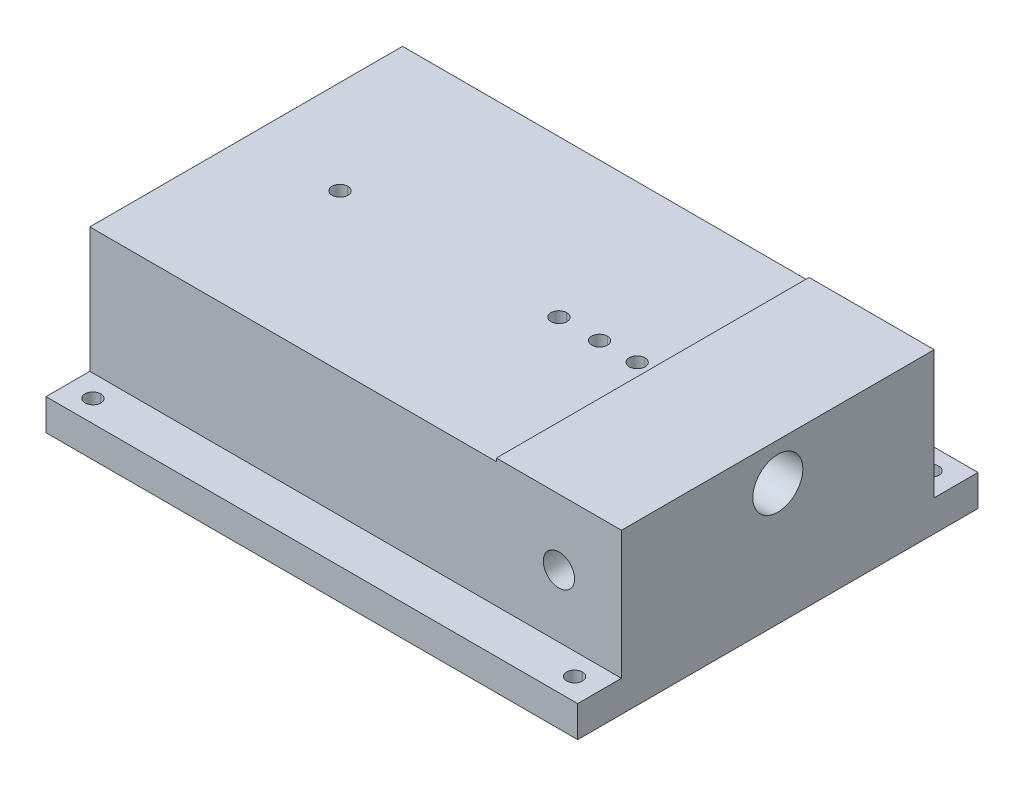
from build123d import *

# Parameters (mm, degrees)
SKETCH1_W                            = 85
SKETCH1_H                            = 64
BOSS_EXTRUDE1_DEPTH                  = 25.5
SKETCH2_W                            = 85
SKETCH2_H                            = 7
CUT_EXTRUDE1_DEPTH                   = 20.5
SKETCH3_W                            = 65
SKETCH3_H                            = 50
CUT_EXTRUDE2_DEPTH                   = 0.5
SKETCH4_R                            = 2.5
CUT_EXTRUDE3_DEPTH                   = 5
SKETCH5_R                            = 4
CUT_EXTRUDE4_DEPTH                   = 8
SKETCH6_R                            = 1.5
CUT_EXTRUDE5_DEPTH                   = 64
TAP_DRILL_SLOT_FOR_M3X0_5_TAP2_DEPTH = 5
TAP_START                            = 20.329155487
TAP_DRILL_SLOT_FOR_M3X0_5_TAP1_DEPTH = 4.670844513


# Read off the part's stored shape, not the designer's step: Tap Drill Slot for M3x0.5 Tap2, Tap Drill Slot for M3x0.5 Tap1
with BuildPart() as part:
    # Sketch1 → Boss-Extrude1 (new body)
    with BuildSketch(Plane(origin=(0, 0, 0), x_dir=(1, 0, 0), z_dir=(0, 1, 0))):
        Rectangle(SKETCH1_W, SKETCH1_H)
    extrude(amount=BOSS_EXTRUDE1_DEPTH)

    # Sketch2 → Cut-Extrude1 (cut)
    with BuildSketch(Plane(origin=(0, 25.5, 0), x_dir=(1, 0, 0), z_dir=(0, 1, 0))):
        with Locations((0, 28.5)):
            Rectangle(SKETCH2_W, SKETCH2_H)
        with Locations((0, -28.5)):
            Rectangle(SKETCH2_W, SKETCH2_H)
    extrude(amount=-CUT_EXTRUDE1_DEPTH, mode=Mode.SUBTRACT)

    # Sketch3 → Cut-Extrude2 (cut)
    with BuildSketch(Plane(origin=(0, 25.5, 0), x_dir=(1, 0, 0), z_dir=(0, 1, 0))):
        with Locations((-10, 0)):
            Rectangle(SKETCH3_W, SKETCH3_H)
    extrude(amount=-CUT_EXTRUDE2_DEPTH, mode=Mode.SUBTRACT)

    # Sketch4 → Cut-Extrude3 (cut)
    with BuildSketch(Plane.XY.offset(25)):
        with Locations((32.5, 15)):
            Circle(SKETCH4_R)
    extrude(amount=-CUT_EXTRUDE3_DEPTH, mode=Mode.SUBTRACT)

    # Sketch5 → Cut-Extrude4 (cut)
    with BuildSketch(Plane(origin=(42.5, 0, 0), x_dir=(0, 0, -1), z_dir=(1, 0, 0))):
        with Locations((0, 19.5)):
            Circle(SKETCH5_R)
    extrude(amount=-CUT_EXTRUDE4_DEPTH, mode=Mode.SUBTRACT)

    # Sketch6 → Cut-Extrude5 (cut)
    with BuildSketch(Plane(origin=(34.5, 0, 0), x_dir=(0, 0, -1), z_dir=(1, 0, 0))):
        with Locations((0, 19.5)):
            Circle(SKETCH6_R)
    extrude(amount=-CUT_EXTRUDE5_DEPTH, mode=Mode.SUBTRACT)

    # Tap Drill Slot for M3x0.5 Tap2 outline → Tap Drill Slot for M3x0.5 Tap2 (cut)
    with BuildSketch(Plane(origin=(0, 0, 0), x_dir=(1, 0, 0), z_dir=(0, 1, 0))):
        with BuildLine():
            Line((-38.52, -29.75), (-38.48, -29.75))
            ThreePointArc((-38.48, -29.75), (-37.23, -28.5), (-38.48, -27.25))
            Line((-38.48, -27.25), (-38.52, -27.25))
            ThreePointArc((-38.52, -27.25), (-39.77, -28.5), (-38.52, -29.75))
        make_face()
        with BuildLine():
            ThreePointArc((38.52, -29.75), (39.77, -28.5), (38.52, -27.25))
            Line((38.52, -27.25), (38.48, -27.25))
            ThreePointArc((38.48, -27.25), (37.23, -28.5), (38.48, -29.75))
            Line((38.48, -29.75), (38.52, -29.75))
        make_face()
        with BuildLine():
            Line((38.48, 27.25), (38.52, 27.25))
            ThreePointArc((38.52, 27.25), (39.77, 28.5), (38.52, 29.75))
            Line((38.52, 29.75), (38.48, 29.75))
            ThreePointArc((38.48, 29.75), (37.23, 28.5), (38.48, 27.25))
        make_face()
        with BuildLine():
            ThreePointArc((-38.48, 27.25), (-37.23, 28.5), (-38.48, 29.75))
            Line((-38.48, 29.75), (-38.52, 29.75))
            ThreePointArc((-38.52, 29.75), (-39.77, 28.5), (-38.52, 27.25))
            Line((-38.52, 27.25), (-38.48, 27.25))
        make_face()
    extrude(amount=TAP_DRILL_SLOT_FOR_M3X0_5_TAP2_DEPTH, mode=Mode.SUBTRACT)

    # Tap Drill Slot for M3x0.5 Tap1 outline → Tap Drill Slot for M3x0.5 Tap1 (cut)
    with BuildSketch(Plane(origin=(0, 0, 0), x_dir=(1, 0, 0), z_dir=(0, 1, 0)).offset(TAP_START)):
        with BuildLine():
            ThreePointArc((19.98, 1.25), (18.73, 0), (19.98, -1.25))
            Line((19.98, -1.25), (20.02, -1.25))
            ThreePointArc((20.02, -1.25), (21.27, 0), (20.02, 1.25))
            Line((20.02, 1.25), (19.98, 1.25))
        make_face()
        with BuildLine():
            ThreePointArc((13.98, 1.25), (12.73, 0), (13.98, -1.25))
            Line((13.98, -1.25), (14.02, -1.25))
            ThreePointArc((14.02, -1.25), (15.27, 0), (14.02, 1.25))
            Line((14.02, 1.25), (13.98, 1.25))
        make_face()
        with BuildLine():
            ThreePointArc((7.48, 1.25), (6.23, 0), (7.48, -1.25))
            Line((7.48, -1.25), (7.52, -1.25))
            ThreePointArc((7.52, -1.25), (8.77, 0), (7.52, 1.25))
            Line((7.52, 1.25), (7.48, 1.25))
        make_face()
        with BuildLine():
            ThreePointArc((-27.52, 1.25), (-28.77, 0), (-27.52, -1.25))
            Line((-27.52, -1.25), (-27.48, -1.25))
            ThreePointArc((-27.48, -1.25), (-26.23, 0), (-27.48, 1.25))
            Line((-27.48, 1.25), (-27.52, 1.25))
        make_face()
    extrude(amount=TAP_DRILL_SLOT_FOR_M3X0_5_TAP1_DEPTH, mode=Mode.SUBTRACT)


solid = part.part
